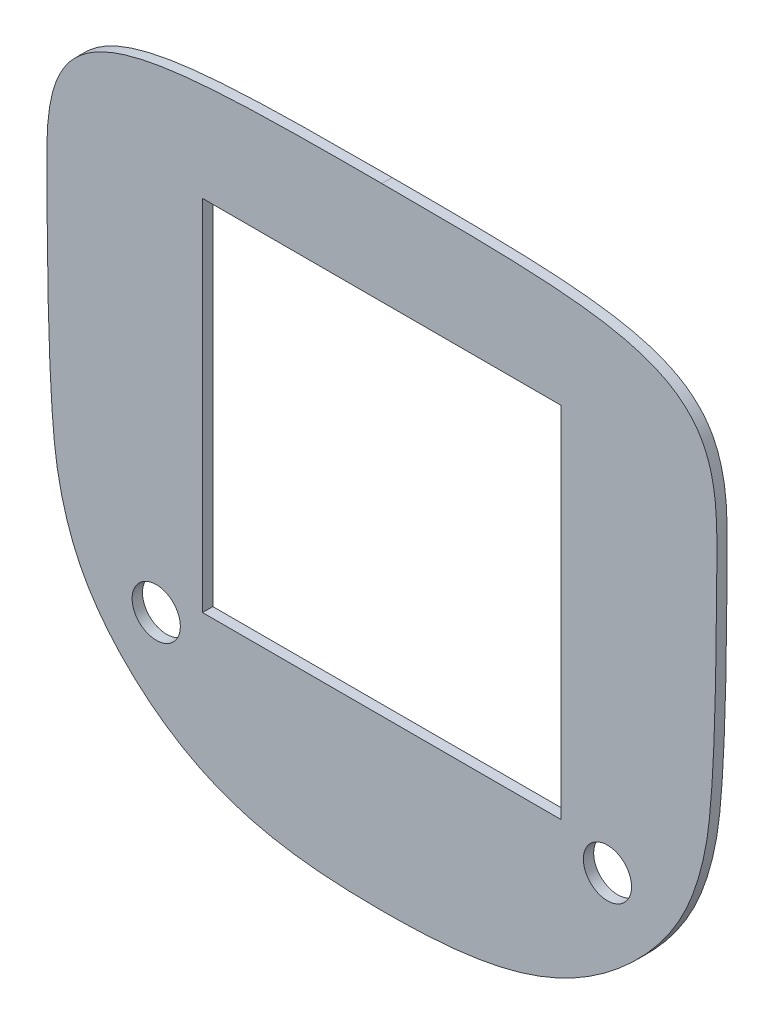
from build123d import *

# Parameters (mm, degrees)
SKETCH1_R           = 7
SKETCH1_R_2         = 7.000000001
SKETCH1_W           = 104.14
SKETCH1_H           = 104.14
BOSS_EXTRUDE1_DEPTH = 3


with BuildPart() as part:
    # Sketch1 → Boss-Extrude1 (new body)
    with BuildSketch(Plane(origin=(0, 0, 100), x_dir=(-1, 0, 0), z_dir=(0, 0, -1))):
        with BuildLine():
            add(Edge.make_bspline(
                [(-1e-09, -73.137085013), (-3.370733736, -73.137085013), (-6.734378943, -73.083771669), (-13.440672959, -72.819229501), (-16.783433063, -72.608837747), (-23.439182049, -71.964142651), (-26.752144152, -71.529637912), (-33.33759261, -70.356207321), (-36.60997649, -69.616510751), (-40.667378232, -68.443107129), (-41.477203817, -68.195980803), (-43.093366771, -67.675493026), (-43.900822122, -67.401729181), (-46.310032737, -66.541796001), (-47.889238607, -65.92044891), (-52.544477218, -63.909421833), (-55.537048564, -62.370824761), (-61.306337859, -58.908491373), (-64.084452162, -56.98724652), (-67.427542086, -54.354533899), (-68.090122652, -53.815906347), (-69.393533804, -52.722974051), (-70.035477989, -52.167844506), (-71.932790396, -50.47714376), (-73.159826692, -49.316427503), (-76.728035335, -45.734077875), (-78.958878587, -43.214525591), (-82.039575544, -39.199501195), (-83.021440244, -37.821191048), (-84.88412339, -34.974890516), (-85.767427654, -33.501005365), (-88.204559187, -29.023741799), (-89.563400092, -25.942835856), (-91.239794175, -21.190749213), (-91.74457302, -19.587205428), (-92.660442382, -16.346272129), (-93.069699195, -14.708220172), (-93.795158786, -11.398499673), (-94.111800727, -9.722957871), (-94.651697476, -6.365781752), (-94.87676845, -4.6830068), (-95.239286804, -1.309281941), (-95.39057167, 0.380376979), (-95.667624115, 3.762075486), (-95.789769063, 5.454453052), (-96.006949572, 8.841737387), (-96.101559279, 10.536683887), (-96.275518719, 13.928000585), (-96.3541526, 15.624404776), (-96.567849925, 20.713768319), (-96.680733557, 24.107568552), (-96.953354403, 34.290958559), (-97.04588188, 41.082678484), (-97.149341973, 51.270007833), (-97.178486911, 54.665842901), (-97.227652976, 59.759535712), (-97.245834664, 61.457370788), (-97.286778342, 64.853283992), (-97.310325044, 66.551469151), (-97.290358192, 69.942854821), (-97.255875699, 71.636726618), (-97.09582269, 75.017699558), (-96.972551619, 76.704971621), (-96.585320654, 80.06905822), (-96.320360567, 81.745798411), (-95.854782835, 83.831735242), (-95.754841059, 84.248415208), (-95.539629218, 85.080635775), (-95.424100672, 85.496934333), (-95.054796974, 86.733533), (-94.777904174, 87.544024069), (-93.84392333, 89.928683353), (-93.083697513, 91.456112273), (-91.917347528, 93.267482281), (-91.672560415, 93.6258059), (-91.167018785, 94.323599626), (-90.905778308, 94.663945051), (-90.097205711, 95.659890217), (-89.525112782, 96.290490077), (-88.317187597, 97.487335056), (-87.6813056, 98.053529952), (-86.682325789, 98.857229484), (-86.341828077, 99.117552429), (-85.646278974, 99.623504122), (-85.290309402, 99.869702545), (-83.492108358, 101.054683185), (-81.989735399, 101.864008562), (-78.891787842, 103.280138886), (-77.295448939, 103.885283055), (-74.849929741, 104.68215643), (-74.025694859, 104.929450071), (-72.377789623, 105.387657064), (-71.552081134, 105.599261026), (-69.070517041, 106.189836208), (-67.410275941, 106.525100239), (-64.081531041, 107.113279731), (-62.412948454, 107.365409975), (-57.397851787, 108.028626666), (-54.042298135, 108.349622004), (-47.317214164, 108.852316963), (-43.947594988, 109.033131006), (-37.200013677, 109.311610648), (-33.821984223, 109.408605309), (-27.060918817, 109.552698361), (-23.677806003, 109.599487384), (-13.530472118, 109.696626212), (-6.765261961, 109.705627481), (0, 109.705627484)],
                knots=[0, 0, 0, 0, 0.03125, 0.03125, 0.0625, 0.0625, 0.09375, 0.09375, 0.125, 0.125, 0.1328125, 0.1328125, 0.140625, 0.140625, 0.15625, 0.15625, 0.1875, 0.1875, 0.21875, 0.21875, 0.2265625, 0.2265625, 0.234375, 0.234375, 0.25, 0.25, 0.28125, 0.28125, 0.296875, 0.296875, 0.3125, 0.3125, 0.34375, 0.34375, 0.359375, 0.359375, 0.375, 0.375, 0.390625, 0.390625, 0.40625, 0.40625, 0.421875, 0.421875, 0.4375, 0.4375, 0.453125, 0.453125, 0.46875, 0.46875, 0.5, 0.5, 0.5625, 0.5625, 0.59375, 0.59375, 0.609375, 0.609375, 0.625, 0.625, 0.640625, 0.640625, 0.65625, 0.65625, 0.671875, 0.671875, 0.67578125, 0.67578125, 0.6796875, 0.6796875, 0.6875, 0.6875, 0.703125, 0.703125, 0.70703125, 0.70703125, 0.7109375, 0.7109375, 0.71875, 0.71875, 0.7265625, 0.7265625, 0.73046875, 0.73046875, 0.734375, 0.734375, 0.75, 0.75, 0.765625, 0.765625, 0.7734375, 0.7734375, 0.78125, 0.78125, 0.796875, 0.796875, 0.8125, 0.8125, 0.84375, 0.84375, 0.875, 0.875, 0.90625, 0.90625, 0.9375, 0.9375, 1, 1, 1, 1], degree=3))
            add(Edge.make_bspline(
                [(-1e-09, -73.137085013), (3.370733735, -73.137085013), (6.734378942, -73.083771669), (13.440672958, -72.819229501), (16.783433062, -72.608837747), (23.439182048, -71.964142651), (26.752144151, -71.529637912), (33.337592609, -70.356207322), (36.609976489, -69.616510752), (40.667378232, -68.44310713), (41.477203816, -68.195980803), (43.093366771, -67.675493027), (43.900822121, -67.401729181), (46.310032736, -66.541796001), (47.889238606, -65.920448911), (52.544477218, -63.909421834), (55.537048563, -62.370824761), (61.306337859, -58.908491374), (64.084452162, -56.98724652), (67.427542085, -54.3545339), (68.090122651, -53.815906348), (69.393533803, -52.722974052), (70.035477989, -52.167844506), (71.932790395, -50.47714376), (73.159826692, -49.316427504), (76.728035334, -45.734077876), (78.958878587, -43.214525592), (82.039575543, -39.199501196), (83.021440244, -37.821191049), (84.884123389, -34.974890517), (85.767427654, -33.501005366), (88.204559186, -29.0237418), (89.563400092, -25.942835857), (91.239794175, -21.190749214), (91.74457302, -19.58720543), (92.660442382, -16.34627213), (93.069699195, -14.708220173), (93.795158786, -11.398499674), (94.111800727, -9.722957872), (94.651697476, -6.365781754), (94.87676845, -4.683006801), (95.239286804, -1.309281942), (95.39057167, 0.380376978), (95.667624115, 3.762075485), (95.789769063, 5.454453051), (96.006949572, 8.841737385), (96.101559279, 10.536683886), (96.275518719, 13.928000584), (96.3541526, 15.624404775), (96.567849925, 20.713768318), (96.680733557, 24.107568551), (96.953354403, 34.290958558), (97.04588188, 41.082678483), (97.149341974, 51.270007832), (97.178486911, 54.6658429), (97.227652977, 59.759535711), (97.245834665, 61.457370787), (97.286778343, 64.853283991), (97.310325044, 66.55146915), (97.290358192, 69.94285482), (97.2558757, 71.636726617), (97.095822691, 75.017699557), (96.97255162, 76.70497162), (96.585320655, 80.069058219), (96.320360568, 81.74579841), (95.854782836, 83.83173524), (95.75484106, 84.248415207), (95.539629219, 85.080635774), (95.424100673, 85.496934331), (95.054796975, 86.733532999), (94.777904175, 87.544024068), (93.843923331, 89.928683352), (93.083697514, 91.456112272), (91.91734753, 93.26748228), (91.672560416, 93.625805898), (91.167018786, 94.323599625), (90.905778309, 94.66394505), (90.097205713, 95.659890216), (89.525112783, 96.290490076), (88.317187599, 97.487335055), (87.681305601, 98.053529951), (86.682325791, 98.857229483), (86.341828078, 99.117552428), (85.646278975, 99.623504121), (85.290309403, 99.869702544), (83.492108359, 101.054683184), (81.9897354, 101.864008561), (78.891787843, 103.280138886), (77.29544894, 103.885283054), (74.849929743, 104.682156429), (74.025694861, 104.92945007), (72.377789624, 105.387657063), (71.552081135, 105.599261025), (69.070517043, 106.189836207), (67.410275942, 106.525100238), (64.081531042, 107.11327973), (62.412948455, 107.365409974), (57.397851788, 108.028626665), (54.042298136, 108.349622003), (47.317214166, 108.852316963), (43.947594989, 109.033131006), (37.200013679, 109.311610647), (33.821984224, 109.408605308), (27.060918818, 109.55269836), (23.677806004, 109.599487383), (13.530472119, 109.696626212), (6.765261962, 109.705627481), (0, 109.705627484)],
                knots=[0, 0, 0, 0, 0.03125, 0.03125, 0.0625, 0.0625, 0.09375, 0.09375, 0.125, 0.125, 0.1328125, 0.1328125, 0.140625, 0.140625, 0.15625, 0.15625, 0.1875, 0.1875, 0.21875, 0.21875, 0.2265625, 0.2265625, 0.234375, 0.234375, 0.25, 0.25, 0.28125, 0.28125, 0.296875, 0.296875, 0.3125, 0.3125, 0.34375, 0.34375, 0.359375, 0.359375, 0.375, 0.375, 0.390625, 0.390625, 0.40625, 0.40625, 0.421875, 0.421875, 0.4375, 0.4375, 0.453125, 0.453125, 0.46875, 0.46875, 0.5, 0.5, 0.5625, 0.5625, 0.59375, 0.59375, 0.609375, 0.609375, 0.625, 0.625, 0.640625, 0.640625, 0.65625, 0.65625, 0.671875, 0.671875, 0.67578125, 0.67578125, 0.6796875, 0.6796875, 0.6875, 0.6875, 0.703125, 0.703125, 0.70703125, 0.70703125, 0.7109375, 0.7109375, 0.71875, 0.71875, 0.7265625, 0.7265625, 0.73046875, 0.73046875, 0.734375, 0.734375, 0.75, 0.75, 0.765625, 0.765625, 0.7734375, 0.7734375, 0.78125, 0.78125, 0.796875, 0.796875, 0.8125, 0.8125, 0.84375, 0.84375, 0.875, 0.875, 0.90625, 0.90625, 0.9375, 0.9375, 1, 1, 1, 1], degree=3))
        make_face()
        with Locations((-65.5, -30.887752409)):
            Circle(SKETCH1_R, mode=Mode.SUBTRACT)
        with Locations((65.5, -30.887752409)):
            Circle(SKETCH1_R_2, mode=Mode.SUBTRACT)
        with Locations((0, 27.871196428)):
            Rectangle(SKETCH1_W, SKETCH1_H, mode=Mode.SUBTRACT)
    extrude(amount=BOSS_EXTRUDE1_DEPTH)


solid = part.part
